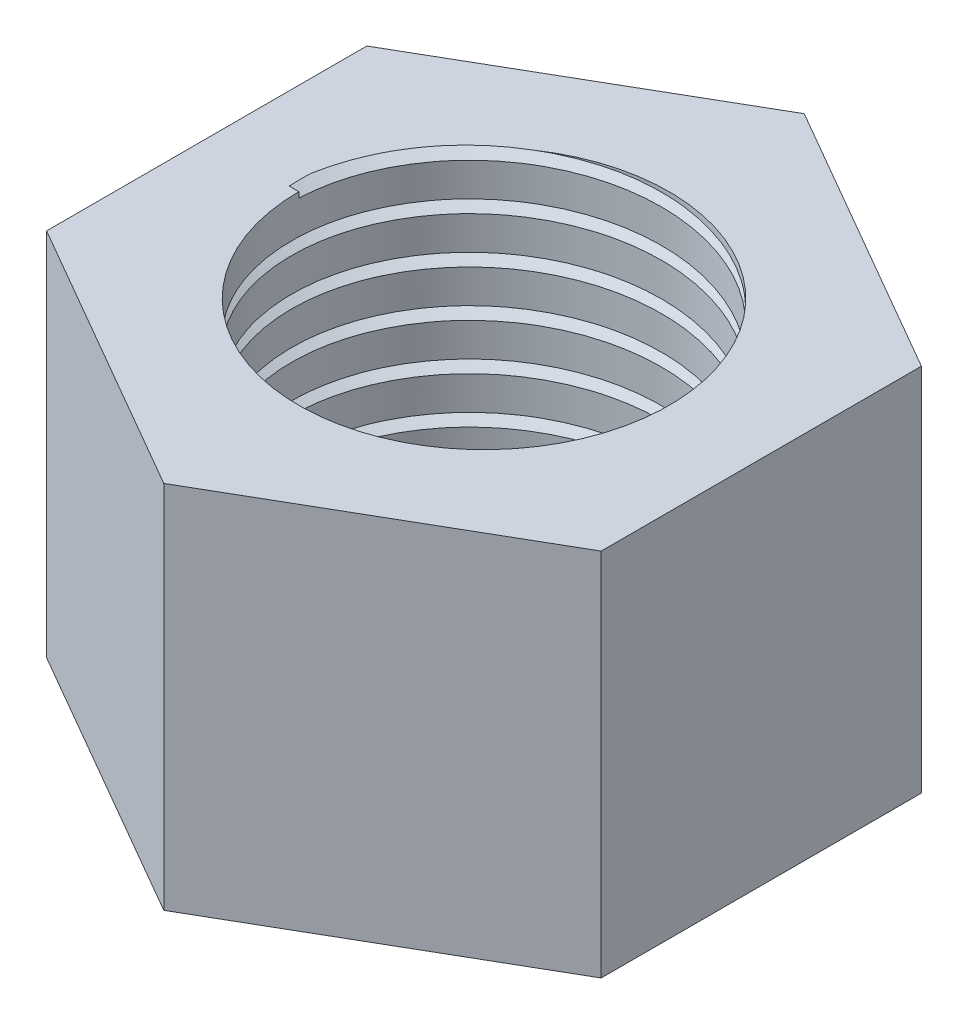
from build123d import *

# Parameters (mm, degrees)
BOSS_EXTRUDE1_DEPTH = 16
SKETCH3_R           = 8.0115
CUT_EXTRUDE1_DEPTH  = 62
CUT_SWEEP2_PITCH    = 2


with BuildPart() as part:
    # Sketch2 → Boss-Extrude1 (new body)
    with BuildSketch(Plane(origin=(0, 0, 0), x_dir=(1, 0, 0), z_dir=(0, 1, 0))):
        Polygon((12, 6.92820323), (0, 13.856406461), (-12, 6.92820323), (-12, -6.92820323), (0, -13.856406461), (12, -6.92820323), align=None)
    extrude(amount=BOSS_EXTRUDE1_DEPTH)

    # Sketch3 → Cut-Extrude1 (cut)
    with BuildSketch(Plane(origin=(0, 16, 0), x_dir=(1, 0, 0), z_dir=(0, 1, 0))):
        with Locations(Location((0, 0, 0), (0, 0, 270))):
            Circle(SKETCH3_R)
    extrude(amount=-CUT_EXTRUDE1_DEPTH, mode=Mode.SUBTRACT)

    # Cut-Sweep2: arcs per turn and ends read off the stored shape
    # Cut-Sweep2: the profile of Sketch7 screwed along a right-hand helix through 8 turns, 10 arcs to a turn; built about Z, then put on its axis
    cut_sweep2_z = Axis((0, 0, 0), (0, 0, 1))
    cut_sweep2_corners = [(8.489015678, 0, -0.034618973), (7.701257282, 0, -0.489431496), (7.701257282, 0, 0.420193549)]
    with BuildLine(mode=Mode.PRIVATE) as cut_sweep2_profile:
        Line(cut_sweep2_corners[0], cut_sweep2_corners[1])
        Line(cut_sweep2_corners[1], cut_sweep2_corners[2])
        Line(cut_sweep2_corners[2], cut_sweep2_corners[0])
    cut_sweep2_cap = Face(cut_sweep2_profile.wire())
    cut_sweep2_turn_angles = [0, 18, 36, 54, 72, 90, 108, 126, 144, 162, 180, 198, 216, 234, 252, 270, 288, 306, 324, 342, 360]
    cut_sweep2_turn_weights = [1, 0.9510565162951535, 1, 0.9510565162951535, 1, 0.9510565162951535, 1, 0.9510565162951535, 1, 0.9510565162951535, 1, 0.9510565162951535, 1, 0.9510565162951535, 1, 0.9510565162951535, 1, 0.9510565162951535, 1, 0.9510565162951535, 1]
    cut_sweep2_turn_rails = [Edge.make_bspline([Vector(p[0], p[1], 0).rotate(cut_sweep2_z, cut_sweep2_turn_angles[k]) / cut_sweep2_turn_weights[k] + Vector(0, 0, p[2] + CUT_SWEEP2_PITCH * cut_sweep2_turn_angles[k] / 360) for k in range(21)], [0, 0, 0, 1, 1, 2, 2, 3, 3, 4, 4, 5, 5, 6, 6, 7, 7, 8, 8, 9, 9, 10, 10, 10], 2, cut_sweep2_turn_weights) for p in cut_sweep2_corners]
    cut_sweep2_turn_sides = [Face.make_surface_from_curves(cut_sweep2_turn_rails[p[0]], cut_sweep2_turn_rails[p[1]]) for p in [(0, 1), (1, 2), (2, 0)]]
    cut_sweep2 = Plane(origin=(0, 16, 0), x_dir=(-1, 0, 0), z_dir=(0, -1, 0)) * Solid(Shell([*[p.moved(Location((0, 0, CUT_SWEEP2_PITCH * i))) for i in range(8) for p in cut_sweep2_turn_sides], cut_sweep2_cap, cut_sweep2_cap.rotate(cut_sweep2_z, 2880).moved(Location((0, 0, CUT_SWEEP2_PITCH * 2880 / 360)))]))
    add(cut_sweep2, mode=Mode.SUBTRACT)


solid = part.part
